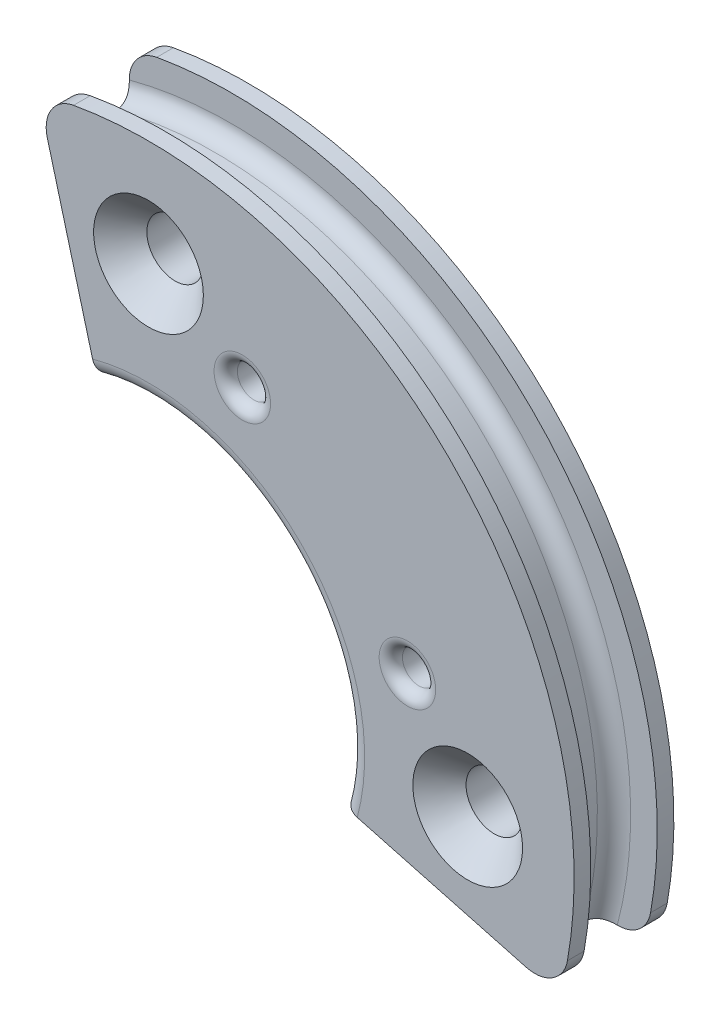
from build123d import *

# Parameters (mm, degrees)
SKETCH1_R               = 12
SKETCH1_R_2             = 0.85
SKETCH1_R_3             = 6
BOSS_EXTRUDE1_DEPTH     = 1.5
SKETCH6_W               = 0.8
SKETCH6_H               = 0.5
CUT_EXTRUDE1_DEPTH      = 19.163975336
CUT_EXTRUDE1_DEPTH_BACK = 19.163975336
CUT_EXTRUDE2_DEPTH      = 19.348841925
CUT_EXTRUDE2_DEPTH_BACK = 19.348841925
SKETCH5_R               = 0.5
FILLET1_R               = 0.5
FILLET2_R               = 1
CHAMFER1_SIZE           = 0.8
FILLET3_R               = 0.35
FILLET4_R               = 0.35


with BuildPart() as part:
    # Sketch1 → Boss-Extrude1 (new, symmetric)
    with BuildSketch(Plane.XY):
        Circle(SKETCH1_R)
        with Locations((9.6, 0)):
            Circle(SKETCH1_R_2, mode=Mode.SUBTRACT)
        Circle(SKETCH1_R_3, mode=Mode.SUBTRACT)
        with Locations((0, -9.6)):
            Circle(SKETCH1_R_2, mode=Mode.SUBTRACT)
        with Locations((-9.6, 0)):
            Circle(SKETCH1_R_2, mode=Mode.SUBTRACT)
        with Locations((0, 9.6)):
            Circle(SKETCH1_R_2, mode=Mode.SUBTRACT)
    extrude(amount=BOSS_EXTRUDE1_DEPTH, both=True)

    # Sketch2 → Cut-Revolve1 (revolve, cut)
    with BuildSketch(Plane(origin=(0, 0, 0), x_dir=(1, 0, 0), z_dir=(0, 1, 0))):
        with BuildLine():
            Line((-11.5, 0.5), (-11.5, -0.5))
            ThreePointArc((-11.5, -0.5), (-11.646446609, -0.853553391), (-12, -1))
            Line((-12, -1), (-12, 1))
            ThreePointArc((-12, 1), (-11.646446609, 0.853553391), (-11.5, 0.5))
        make_face()
    revolve(axis=Axis((0, 0, 0), (0, 0, -1)), mode=Mode.SUBTRACT)

    # Sketch6 → Revolve1 (revolve)
    with BuildSketch(Plane(origin=(0, 0, 0), x_dir=(1, 0, 0), z_dir=(0, 1, 0))):
        with Locations((12.4, 1.25)):
            Rectangle(SKETCH6_W, SKETCH6_H)
        with Locations((12.4, -1.25)):
            Rectangle(SKETCH6_W, SKETCH6_H)
    revolve(axis=Axis((0, 0, 0), (0, 0, -1)))

    # Sketch4 → Cut-Extrude1 (cut, two sides: drawn at the far end of the back side and taken through both)
    with BuildSketch(Plane.XY.offset(-CUT_EXTRUDE1_DEPTH_BACK)):
        Polygon((-3.743635752, 13.97143883), (0, 0), (14.900233226, -3.99250546), (14.900233226, -14.839385646), (-15.188066433, -14.839385646), (-15.188066433, 13.97143883), align=None)
    extrude(amount=CUT_EXTRUDE1_DEPTH + CUT_EXTRUDE1_DEPTH_BACK, mode=Mode.SUBTRACT)

    # Sketch5 → Cut-Extrude2 (cut, two sides: drawn at the far end of the back side and taken through both)
    with BuildSketch(Plane.XY.offset(1.5).offset(-CUT_EXTRUDE2_DEPTH_BACK)):
        with Locations((2.82143232, 7.787460269)):
            Circle(SKETCH5_R)
        with Locations((7.787460269, 2.82143232)):
            Circle(SKETCH5_R)
    extrude(amount=CUT_EXTRUDE2_DEPTH + CUT_EXTRUDE2_DEPTH_BACK, mode=Mode.SUBTRACT)

    # Fillet1
    fillet1_edges = [part.edges().sort_by_distance(p)[0] for p in [
        (4.242640687, 4.242640687, 1.5),
        (4.242640687, 4.242640687, -1.5),
    ]]
    fillet(fillet1_edges, radius=FILLET1_R)

    # Fillet2
    fillet2_edges = [part.edges().sort_by_distance(p)[0] for p in [
        (12.363850577, -3.312883777, -1.25),
        (12.363850577, -3.312883777, 1.25),
        (-3.312883777, 12.363850577, -1.25),
        (-3.312883777, 12.363850577, 1.25),
    ]]
    fillet(fillet2_edges, radius=FILLET2_R)

    # Chamfer1
    chamfer1_edges = [part.edges().sort_by_distance(p)[0] for p in [
        (8.75, 0, 1.5),
        (-0.85, 9.6, 1.5),
    ]]
    chamfer(chamfer1_edges, length=CHAMFER1_SIZE)

    # Fillet3
    fillet3_edges = [part.edges().sort_by_distance(p)[0] for p in [
        (2.32143232, 7.787460269, 1.5),
        (7.287460269, 2.82143232, 1.5),
    ]]
    fillet(fillet3_edges, radius=FILLET3_R)

    # Fillet4
    fillet4_edges = [part.edges().sort_by_distance(p)[0] for p in [
        (7.287460269, 2.82143232, -1.5),
        (2.32143232, 7.787460269, -1.5),
    ]]
    fillet(fillet4_edges, radius=FILLET4_R)


solid = part.part
